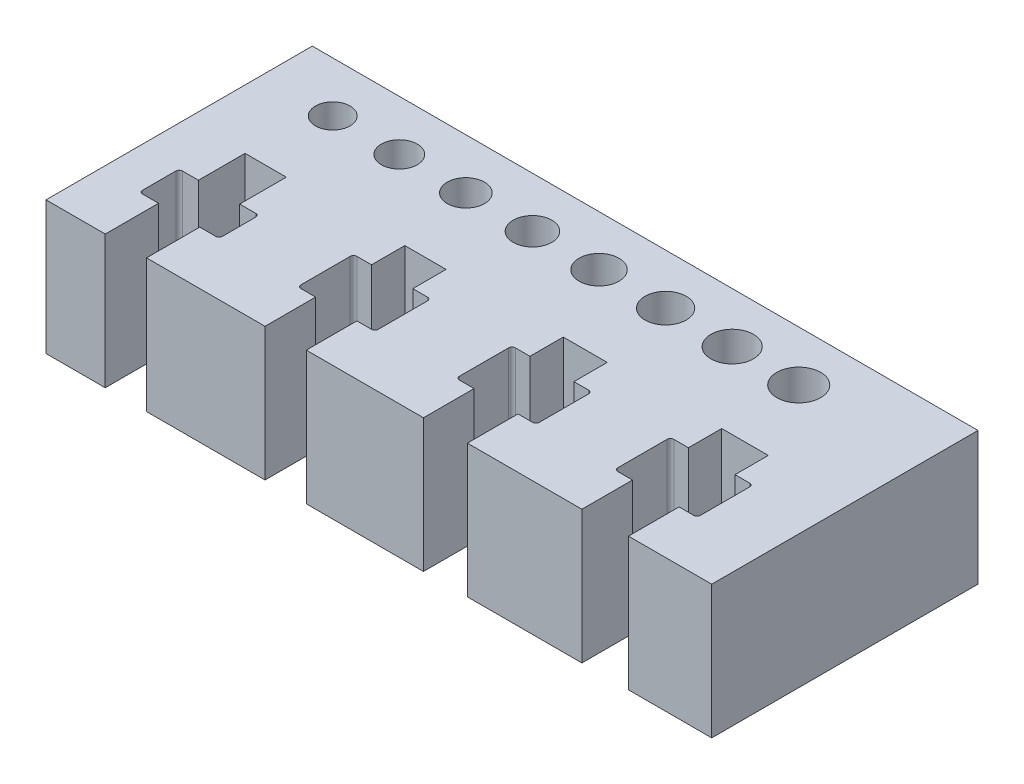
from build123d import *

# Parameters (mm, degrees)
SKETCH2_W           = 50
SKETCH2_H           = 20
BOSS_EXTRUDE1_DEPTH = 10
SKETCH3_R           = 1.3
SKETCH3_R_2         = 1.35
SKETCH3_R_3         = 1.4
SKETCH3_R_4         = 1.45
SKETCH3_R_5         = 1.5
SKETCH3_R_6         = 1.55
SKETCH3_R_7         = 1.6
SKETCH3_R_8         = 1.65
CUT_EXTRUDE1_DEPTH  = 29.722813233


with BuildPart() as part:
    # Sketch2 → Boss-Extrude1 (new body)
    with BuildSketch(Plane(origin=(0, 0, 0), x_dir=(1, 0, 0), z_dir=(0, 1, 0))):
        Rectangle(SKETCH2_W, SKETCH2_H)
    extrude(amount=BOSS_EXTRUDE1_DEPTH)

    # Sketch3 → Cut-Extrude1 (cut, through all)
    with BuildSketch(Plane(origin=(0, 10, 0), x_dir=(1, 0, 0), z_dir=(0, 1, 0))):
        with Locations((-19.685722489, 6.222302146)):
            Circle(SKETCH3_R)
        with Locations((-14.685722489, 6.222302146)):
            Circle(SKETCH3_R_2)
        with Locations((-9.685722489, 6.222302146)):
            Circle(SKETCH3_R_3)
        with Locations((-4.685722489, 6.222302146)):
            Circle(SKETCH3_R_4)
        with Locations((0.314277511, 6.222302146)):
            Circle(SKETCH3_R_5)
        with Locations((5.314277511, 6.222302146)):
            Circle(SKETCH3_R_6)
        with Locations((10.314277511, 6.222302146)):
            Circle(SKETCH3_R_7)
        with Locations((15.314277511, 6.222302146)):
            Circle(SKETCH3_R_8)
        with BuildLine():
            Line((6.65, -10), (3.35, -10))
            Line((3.35, -10), (3.35, -6.2))
            Line((3.35, -6.2), (2.25, -6.2))
            ThreePointArc((2.25, -6.2), (2.073223305, -6.126776695), (2, -5.95))
            Line((2, -5.95), (2, -2.25))
            ThreePointArc((2, -2.25), (2.073223305, -2.073223305), (2.25, -2))
            Line((2.25, -2), (3.35, -2))
            Line((3.35, -2), (3.35, 0.5))
            Line((3.35, 0.5), (6.65, 0.5))
            Line((6.65, 0.5), (6.65, -2))
            Line((6.65, -2), (7.75, -2))
            ThreePointArc((7.75, -2), (7.926776695, -2.073223305), (8, -2.25))
            Line((8, -2.25), (8, -5.95))
            ThreePointArc((8, -5.95), (7.926776695, -6.126776695), (7.75, -6.2))
            Line((7.75, -6.2), (6.65, -6.2))
            Line((6.65, -6.2), (6.65, -10))
        make_face()
        with BuildLine():
            Line((15.25, 0.5), (18.75, 0.5))
            Line((18.75, 0.5), (18.75, -2))
            Line((18.75, -2), (19.85, -2))
            ThreePointArc((19.85, -2), (20.026776695, -2.073223305), (20.1, -2.25))
            Line((20.1, -2.25), (20.1, -5.95))
            ThreePointArc((20.1, -5.95), (20.026776695, -6.126776695), (19.85, -6.2))
            Line((19.85, -6.2), (18.75, -6.2))
            Line((18.75, -6.2), (18.75, -10))
            Line((18.75, -10), (15.25, -10))
            Line((15.25, -10), (15.25, -6.2))
            Line((15.25, -6.2), (14.15, -6.2))
            ThreePointArc((14.15, -6.2), (13.973223305, -6.126776695), (13.9, -5.95))
            Line((13.9, -5.95), (13.9, -2.25))
            ThreePointArc((13.9, -2.25), (13.973223305, -2.073223305), (14.15, -2))
            Line((14.15, -2), (15.25, -2))
            Line((15.25, -2), (15.25, 0.5))
        make_face()
        with BuildLine():
            Line((-8.55, 0.5), (-5.45, 0.5))
            Line((-5.45, 0.5), (-5.45, -2))
            Line((-5.45, -2), (-4.35, -2))
            ThreePointArc((-4.35, -2), (-4.173223305, -2.073223305), (-4.1, -2.25))
            Line((-4.1, -2.25), (-4.1, -5.95))
            ThreePointArc((-4.1, -5.95), (-4.173223305, -6.126776695), (-4.35, -6.2))
            Line((-4.35, -6.2), (-5.45, -6.2))
            Line((-5.45, -6.2), (-5.45, -10))
            Line((-5.45, -10), (-8.55, -10))
            Line((-8.55, -10), (-8.55, -6.2))
            Line((-8.55, -6.2), (-9.65, -6.2))
            ThreePointArc((-9.65, -6.2), (-9.826776695, -6.126776695), (-9.9, -5.95))
            Line((-9.9, -5.95), (-9.9, -2.25))
            ThreePointArc((-9.9, -2.25), (-9.826776695, -2.073223305), (-9.65, -2))
            Line((-9.65, -2), (-8.55, -2))
            Line((-8.55, -2), (-8.55, 0.5))
        make_face()
        with BuildLine():
            Line((-20.55, 0.5), (-17.45, 0.5))
            Line((-17.45, 0.5), (-17.45, -3))
            Line((-17.45, -3), (-16.25, -3))
            ThreePointArc((-16.25, -3), (-16.073223305, -3.073223305), (-16, -3.25))
            Line((-16, -3.25), (-16, -5.75))
            ThreePointArc((-16, -5.75), (-16.073223305, -5.926776695), (-16.25, -6))
            Line((-16.25, -6), (-17.45, -6))
            Line((-17.45, -6), (-17.45, -10))
            Line((-17.45, -10), (-20.55, -10))
            Line((-20.55, -10), (-20.55, -6))
            Line((-20.55, -6), (-21.75, -6))
            ThreePointArc((-21.75, -6), (-21.926776695, -5.926776695), (-22, -5.75))
            Line((-22, -5.75), (-22, -3.25))
            ThreePointArc((-22, -3.25), (-21.926776695, -3.073223305), (-21.75, -3))
            Line((-21.75, -3), (-20.55, -3))
            Line((-20.55, -3), (-20.55, 0.5))
        make_face()
    extrude(amount=-CUT_EXTRUDE1_DEPTH, mode=Mode.SUBTRACT)


solid = part.part
